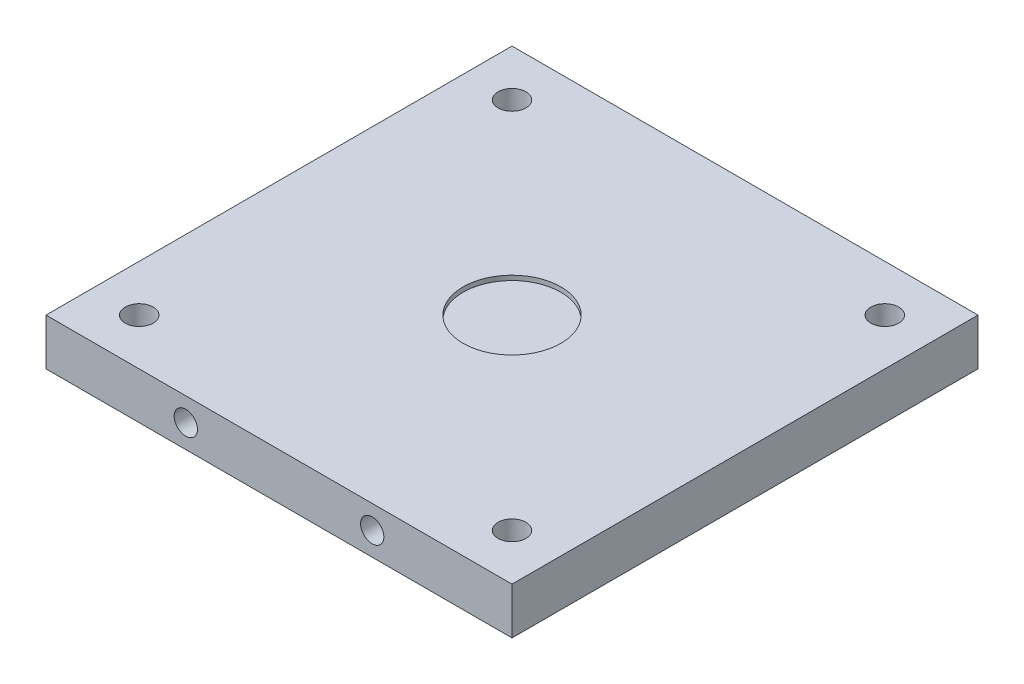
from build123d import *

# Parameters (mm, degrees)
SKETCH1_W           = 100
SKETCH1_H           = 100
BASE_DEPTH          = 10
SKETCH2_R           = 10.5
LOAD_CELL_CUT_DEPTH = 1
CUT_EXTRUDE1_REACH  = 73.414
SKETCH15_R          = 3
SKETCH21_R          = 2.5
CUT_EXTRUDE2_DEPTH  = 10


with BuildPart() as part:
    # Sketch1 → base (new body)
    with BuildSketch(Plane(origin=(0, 0, 0), x_dir=(1, 0, 0), z_dir=(0, 1, 0))):
        Rectangle(SKETCH1_W, SKETCH1_H)
    extrude(amount=BASE_DEPTH)

    # Sketch2 → load cell cut (cut)
    with BuildSketch(Plane(origin=(0, 10, 0), x_dir=(1, 0, 0), z_dir=(0, 1, 0))):
        Circle(SKETCH2_R)
    extrude(amount=-LOAD_CELL_CUT_DEPTH, mode=Mode.SUBTRACT)

    # Sketch15 → Cut-Extrude1 (cut, up to next)
    with BuildSketch(Plane(origin=(0, 0, 0), x_dir=(-1, 0, 0), z_dir=(0, -1, 0)), mode=Mode.PRIVATE) as cut_extrude1_sk1:
        with Locations((40, -40)):
            Circle(SKETCH15_R)
    cut_extrude1_tool1 = extrude(cut_extrude1_sk1.sketch, amount=-CUT_EXTRUDE1_REACH, mode=Mode.PRIVATE) & part.part
    # Sketch15 → Cut-Extrude1 (cut, up to next)
    with BuildSketch(Plane(origin=(0, 0, 0), x_dir=(-1, 0, 0), z_dir=(0, -1, 0)), mode=Mode.PRIVATE) as cut_extrude1_sk2:
        with Locations((-40, -40)):
            Circle(SKETCH15_R)
    cut_extrude1_tool2 = extrude(cut_extrude1_sk2.sketch, amount=-CUT_EXTRUDE1_REACH, mode=Mode.PRIVATE) & part.part
    # Sketch15 → Cut-Extrude1 (cut, up to next)
    with BuildSketch(Plane(origin=(0, 0, 0), x_dir=(-1, 0, 0), z_dir=(0, -1, 0)), mode=Mode.PRIVATE) as cut_extrude1_sk3:
        with Locations((40, 40)):
            Circle(SKETCH15_R)
    cut_extrude1_tool3 = extrude(cut_extrude1_sk3.sketch, amount=-CUT_EXTRUDE1_REACH, mode=Mode.PRIVATE) & part.part
    # Sketch15 → Cut-Extrude1 (cut, up to next)
    with BuildSketch(Plane(origin=(0, 0, 0), x_dir=(-1, 0, 0), z_dir=(0, -1, 0)), mode=Mode.PRIVATE) as cut_extrude1_sk4:
        with Locations((-40, 40)):
            Circle(SKETCH15_R)
    cut_extrude1_tool4 = extrude(cut_extrude1_sk4.sketch, amount=-CUT_EXTRUDE1_REACH, mode=Mode.PRIVATE) & part.part
    add(cut_extrude1_tool1.solids().sort_by_distance((-40, 0, 40))[0], mode=Mode.SUBTRACT)
    add(cut_extrude1_tool2.solids().sort_by_distance((40, 0, 40))[0], mode=Mode.SUBTRACT)
    add(cut_extrude1_tool3.solids().sort_by_distance((-40, 0, -40))[0], mode=Mode.SUBTRACT)
    add(cut_extrude1_tool4.solids().sort_by_distance((40, 0, -40))[0], mode=Mode.SUBTRACT)

    # Sketch21 → Cut-Extrude2 (cut)
    with BuildSketch(Plane(origin=(0, 0, -50), x_dir=(-1, 0, 0), z_dir=(0, 0, -1))):
        with Locations((-20, 5)):
            Circle(SKETCH21_R)
        with Locations((20, 5)):
            Circle(SKETCH21_R)
    cut_extrude2 = extrude(amount=-CUT_EXTRUDE2_DEPTH, mode=Mode.SUBTRACT)

    # Mirror2: Cut-Extrude2 across plane
    add(cut_extrude2.mirror(Plane.XY), mode=Mode.SUBTRACT)


solid = part.part
